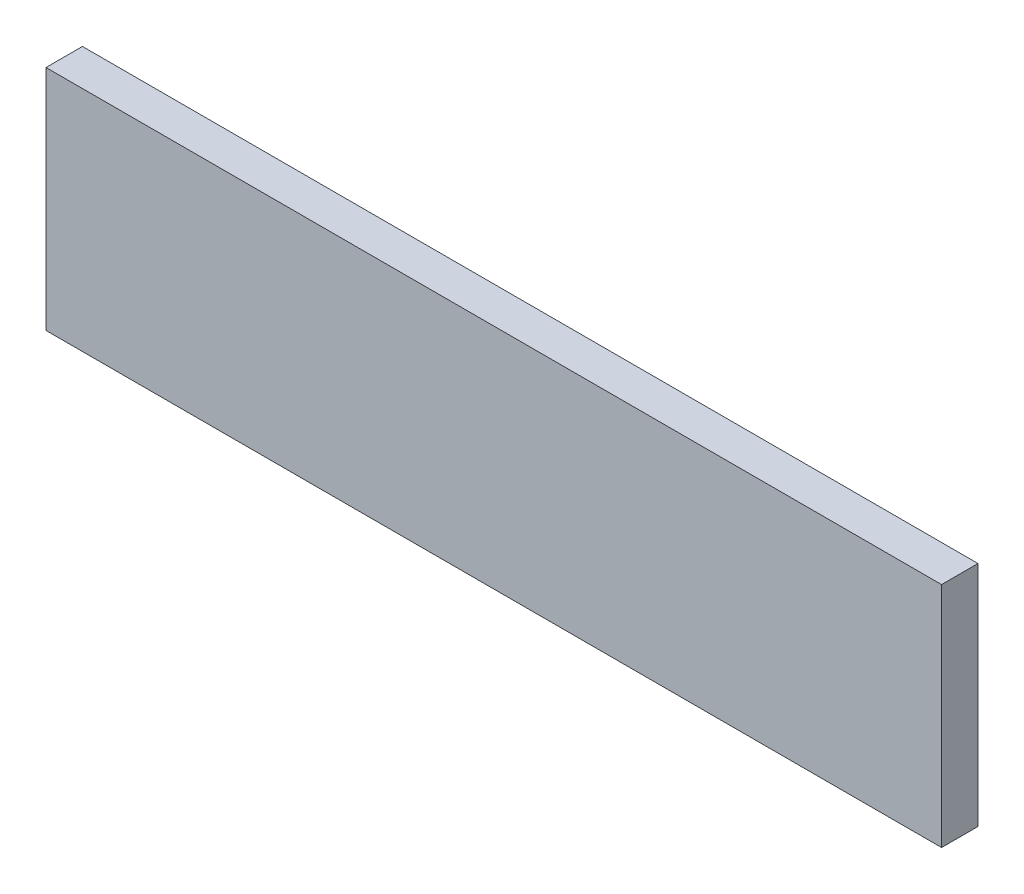
from build123d import *

# Parameters (mm, degrees)
SKETCH1_W           = 468.1
SKETCH1_H           = 119.05
BOSS_EXTRUDE1_DEPTH = 19.05


with BuildPart() as part:
    # Sketch1 → Boss-Extrude1 (new body)
    with BuildSketch(Plane.XY):
        with Locations((0, 59.525)):
            Rectangle(SKETCH1_W, SKETCH1_H)
    extrude(amount=BOSS_EXTRUDE1_DEPTH)


solid = part.part
